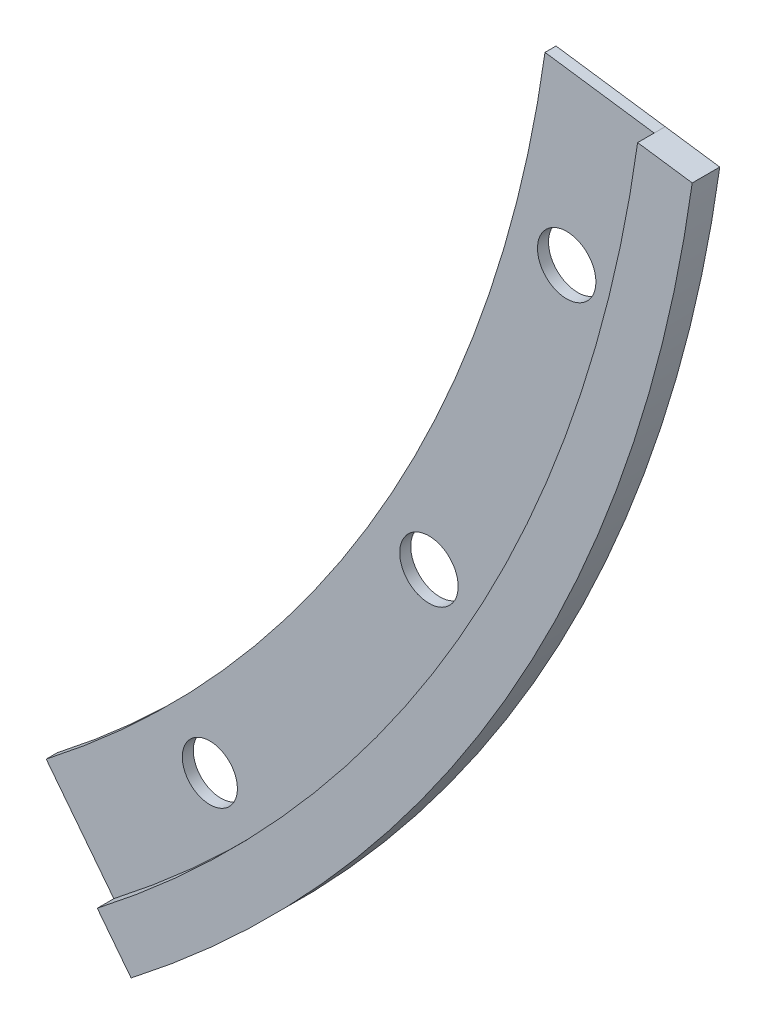
from build123d import *

# Parameters (mm, degrees)
SALIENTE_EXTRUIR1_OUTLINE_R   = 260
SALIENTE_EXTRUIR1_OUTLINE_R_2 = 5
SALIENTE_EXTRUIR1_OUTLINE_R_3 = 5.3
SALIENTE_EXTRUIR1_OUTLINE_R_4 = 240
SALIENTE_EXTRUIR1_DEPTH       = 2
CROQUIS4_R                    = 270
CROQUIS4_R_2                  = 260
SALIENTE_EXTRUIR2_DEPTH       = 5
CORTAR_EXTRUIR6_DEPTH         = 5


# Read off the part's stored shape, not the designer's step: Saliente-Extruir1
with BuildPart() as part:
    # Saliente-Extruir1 outline → Saliente-Extruir1 (new body)
    with BuildSketch(Plane.XY):
        Circle(SALIENTE_EXTRUIR1_OUTLINE_R)
        with Locations((176.875677676, -176.875677676)):
            Circle(SALIENTE_EXTRUIR1_OUTLINE_R_2, mode=Mode.SUBTRACT)
        with Locations((216.627579108, -125.069991112)):
            Circle(SALIENTE_EXTRUIR1_OUTLINE_R_3, mode=Mode.SUBTRACT)
        with Locations((241.616669018, -64.740991341)):
            Circle(SALIENTE_EXTRUIR1_OUTLINE_R_3, mode=Mode.SUBTRACT)
        Circle(SALIENTE_EXTRUIR1_OUTLINE_R_4, mode=Mode.SUBTRACT)
        with Locations((250.139982224, 0)):
            Circle(SALIENTE_EXTRUIR1_OUTLINE_R_3, mode=Mode.SUBTRACT)
    extrude(amount=SALIENTE_EXTRUIR1_DEPTH)


with BuildPart() as body_2:
    # Croquis4 → Saliente-Extruir2 (new body)
    with BuildSketch(Plane(origin=(0, 0, 0), x_dir=(-1, 0, 0), z_dir=(0, 0, -1))):
        Circle(CROQUIS4_R)
        Circle(CROQUIS4_R_2, mode=Mode.SUBTRACT)
    extrude(amount=-SALIENTE_EXTRUIR2_DEPTH)


with BuildPart() as cortar_extruir6_tool:
    # Croquis6 → Cortar-Extruir6 (new body)
    with BuildSketch(Plane.XY.offset(5)):
        Polygon((0, 0), (344.486187081, -443.656453058), (-54.282671904, -619.031239208), (-747.430636211, -376.847010715), (-569.968054988, 500.026920035), (311.081465909, 596.065493403), (741.167250991, 61.58995466), (694.934547582, -97.295904018), align=None)
    extrude(amount=-CORTAR_EXTRUIR6_DEPTH)


with BuildPart() as part_1:
    add(part.part)

    # Cortar-Extruir6: cut by cortar_extruir6_tool
    add(cortar_extruir6_tool.part, mode=Mode.SUBTRACT)


with BuildPart() as body_2_1:
    add(body_2.part)

    # Cortar-Extruir6: cut by cortar_extruir6_tool
    add(cortar_extruir6_tool.part, mode=Mode.SUBTRACT)


solid = Compound([part_1.part, body_2_1.part])
